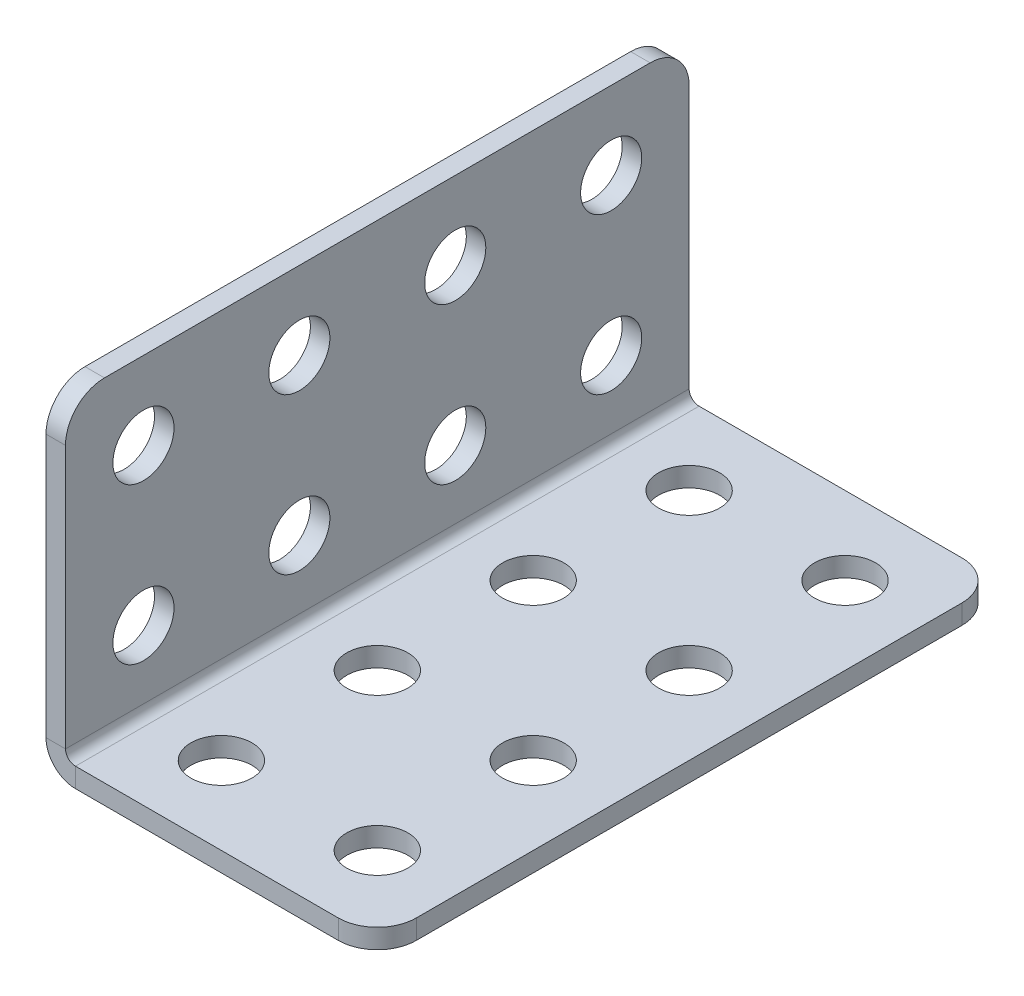
from build123d import *

# Parameters (mm, degrees)
BASE_FLANGE1_DEPTH = 50.8
SKETCH6_R          = 2.4892
CUT_EXTRUDE1_DEPTH = 63.217039467
SKETCH7_R          = 2.4892
CUT_EXTRUDE2_DEPTH = 63.217039467
FILLET1_R          = 3.175


# Read off the part's stored shape, not the designer's step: Base-Flange1
with BuildPart() as part:
    # Base-Flange1 outline → Base-Flange1 (new body)
    with BuildSketch(Plane.XY):
        with BuildLine():
            Line((0.8128, -1.5875), (25.4, -1.5875))
            Line((25.4, -1.5875), (25.4, 0))
            Line((25.4, 0), (0.8128, 0))
            ThreePointArc((0.8128, 0), (0.238063608, 0.238063608), (0, 0.8128))
            Line((0, 0.8128), (0, 25.4))
            Line((0, 25.4), (-1.5875, 25.4))
            Line((-1.5875, 25.4), (-1.5875, 0.8128))
            ThreePointArc((-1.5875, 0.8128), (-0.884468407, -0.884468407), (0.8128, -1.5875))
        make_face()
    extrude(amount=BASE_FLANGE1_DEPTH)

    # Sketch6 → Cut-Extrude1 (cut, through all)
    with BuildSketch(Plane(origin=(0, 0, 0), x_dir=(0, 0, -1), z_dir=(1, 0, 0))):
        with Locations((-44.45, 19.05)):
            Circle(SKETCH6_R)
        with Locations((-31.75, 19.05)):
            Circle(SKETCH6_R)
        with Locations((-19.05, 19.05)):
            Circle(SKETCH6_R)
        with Locations((-6.35, 19.05)):
            Circle(SKETCH6_R)
        with Locations((-6.35, 6.35)):
            Circle(SKETCH6_R)
        with Locations((-19.05, 6.35)):
            Circle(SKETCH6_R)
        with Locations((-31.75, 6.35)):
            Circle(SKETCH6_R)
        with Locations((-44.45, 6.35)):
            Circle(SKETCH6_R)
    extrude(amount=-CUT_EXTRUDE1_DEPTH, mode=Mode.SUBTRACT)

    # Sketch7 → Cut-Extrude2 (cut, through all)
    with BuildSketch(Plane(origin=(0, 0, 0), x_dir=(1, 0, 0), z_dir=(0, 1, 0))):
        with Locations(Location((19.05, -6.35, 0), (0, 0, 270))):
            Circle(SKETCH7_R)
        with Locations(Location((19.05, -19.05, 0), (0, 0, 270))):
            Circle(SKETCH7_R)
        with Locations(Location((6.35, -19.05, 0), (0, 0, 270))):
            Circle(SKETCH7_R)
        with Locations(Location((6.35, -6.35, 0), (0, 0, 270))):
            Circle(SKETCH7_R)
        with Locations(Location((19.05, -31.75, 0), (0, 0, 270))):
            Circle(SKETCH7_R)
        with Locations(Location((19.05, -44.45, 0), (0, 0, 270))):
            Circle(SKETCH7_R)
        with Locations(Location((6.35, -31.75, 0), (0, 0, 270))):
            Circle(SKETCH7_R)
        with Locations(Location((6.35, -44.45, 0), (0, 0, 270))):
            Circle(SKETCH7_R)
    extrude(amount=-CUT_EXTRUDE2_DEPTH, mode=Mode.SUBTRACT)

    # Fillet1
    fillet1_edges = [part.edges().sort_by_distance(p)[0] for p in [
        (-0.79375, 25.4, 50.8),
        (-0.79375, 25.4, 0),
        (25.4, -0.79375, 50.8),
        (25.4, -0.79375, 0),
    ]]
    fillet(fillet1_edges, radius=FILLET1_R)


solid = part.part
